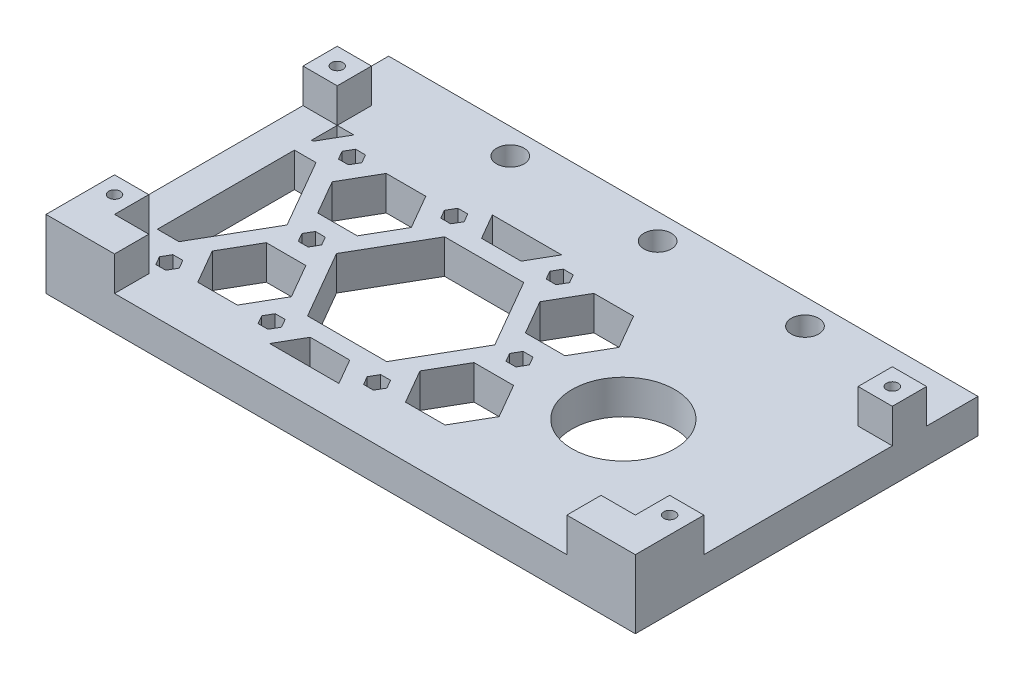
from build123d import *

# Parameters (mm, degrees)
SKETCH1_W           = 172
SKETCH1_H           = 100
SKETCH1_R           = 1.655795395
SKETCH1_R_2         = 15
BOSS_EXTRUDE1_DEPTH = 2.5
BOSS_EXTRUDE2_START = 7.5
SKETCH1_3_W         = 172
SKETCH1_3_H         = 100
SKETCH1_3_R         = 4
SKETCH1_3_R_2       = 15
BOSS_EXTRUDE2_DEPTH = 7.5
SKETCH3_W           = 10
SKETCH3_H           = 10
BOSS_EXTRUDE3_DEPTH = 10
SKETCH4_R           = 1.7
CUT_EXTRUDE1_DEPTH  = 200.959995999
CUT_EXTRUDE2_DEPTH  = 2.5
CUT_EXTRUDE3_DEPTH  = 200.208433556


with BuildPart() as part:
    # Sketch1 → Boss-Extrude1 (new body)
    with BuildSketch(Plane(origin=(0, 0, 0), x_dir=(1, 0, 0), z_dir=(0, 1, 0))):
        with Locations((86, 50)):
            Rectangle(SKETCH1_W, SKETCH1_H)
        with Locations((43, 92.5)):
            Circle(SKETCH1_R, mode=Mode.SUBTRACT)
        with Locations((86, 92.5)):
            Circle(SKETCH1_R, mode=Mode.SUBTRACT)
        with Locations((129, 92.5)):
            Circle(SKETCH1_R, mode=Mode.SUBTRACT)
        with Locations((126, 42.5)):
            Circle(SKETCH1_R_2, mode=Mode.SUBTRACT)
    extrude(amount=-BOSS_EXTRUDE1_DEPTH)

    # Sketch1<3> → Boss-Extrude2 (add)
    with BuildSketch(Plane(origin=(0, 0, 0), x_dir=(1, 0, 0), z_dir=(0, 1, 0)).offset(BOSS_EXTRUDE2_START)):
        with Locations((86, 50)):
            Rectangle(SKETCH1_3_W, SKETCH1_3_H)
        with Locations((43, 92.5)):
            Circle(SKETCH1_3_R, mode=Mode.SUBTRACT)
        with Locations((86, 92.5)):
            Circle(SKETCH1_3_R, mode=Mode.SUBTRACT)
        with Locations((129, 92.5)):
            Circle(SKETCH1_3_R, mode=Mode.SUBTRACT)
        with Locations((126, 42.5)):
            Circle(SKETCH1_3_R_2, mode=Mode.SUBTRACT)
    extrude(amount=-BOSS_EXTRUDE2_DEPTH)

    # Sketch3 → Boss-Extrude3 (add)
    with BuildSketch(Plane(origin=(0, 7.5, 0), x_dir=(1, 0, 0), z_dir=(0, 1, 0))):
        with Locations((5, 80)):
            Rectangle(SKETCH3_W, SKETCH3_H)
        with Locations((167, 80)):
            Rectangle(SKETCH3_W, SKETCH3_H)
        Polygon((10, 20), (0, 20), (0, 0), (20, 0), (20, 10), (10, 10), align=None)
        Polygon((172, 0), (172, 20), (162, 20), (162, 10), (152, 10), (152, 0), align=None)
    extrude(amount=BOSS_EXTRUDE3_DEPTH)

    # Sketch4 → Cut-Extrude1 (cut, through all)
    with BuildSketch(Plane(origin=(0, 17.5, 0), x_dir=(1, 0, 0), z_dir=(0, 1, 0))):
        with Locations((5, 80)):
            Circle(SKETCH4_R)
        with Locations((5, 15)):
            Circle(SKETCH4_R)
        with Locations((167, 15)):
            Circle(SKETCH4_R)
        with Locations((167, 80)):
            Circle(SKETCH4_R)
    extrude(amount=-CUT_EXTRUDE1_DEPTH, mode=Mode.SUBTRACT)

    # Sketch5 → Cut-Extrude2 (cut)
    with BuildSketch(Plane(origin=(0, -2.5, 0), x_dir=(-1, 0, 0), z_dir=(0, -1, 0))):
        Polygon((-163.766838493, 80), (-165.383419246, 82.8), (-168.616580754, 82.8), (-170.233161507, 80), (-168.616580754, 77.2), (-165.383419246, 77.2), align=None)
        Polygon((-163.766838493, 15), (-165.383419246, 17.8), (-168.616580754, 17.8), (-170.233161507, 15), (-168.616580754, 12.2), (-165.383419246, 12.2), align=None)
        Polygon((-1.766838493, 15), (-3.383419246, 17.8), (-6.616580754, 17.8), (-8.233161507, 15), (-6.616580754, 12.2), (-3.383419246, 12.2), align=None)
        Polygon((-1.766838493, 80), (-3.383419246, 82.8), (-6.616580754, 82.8), (-8.233161507, 80), (-6.616580754, 77.2), (-3.383419246, 77.2), align=None)
    extrude(amount=-CUT_EXTRUDE2_DEPTH, mode=Mode.SUBTRACT)

    # Sketch6 → Cut-Extrude3 (cut, through all)
    with BuildSketch(Plane(origin=(0, 7.5, 0), x_dir=(1, 0, 0), z_dir=(0, 1, 0))):
        Polygon((14.860073181, 75), (10, 75), (10, 67.5), (10.529946162, 67.5), align=None)
        Polygon((55.274592024, 75), (59.604719043, 67.5), (71.151724427, 67.5), (75.481851446, 75), align=None)
        Polygon((16.303448854, 62.5), (10, 62.5), (10, 22.5), (16.303448854, 22.5), (27.850454238, 42.5), align=None)
        Polygon((10.529946162, 17.5), (10, 17.5), (10, 10), (14.860073181, 10), align=None)
        Polygon((59.604719043, 17.5), (55.274592024, 10), (75.481851446, 10), (71.151724427, 17.5), align=None)
        Polygon((107.236116251, 25), (101.462613559, 35), (89.915608176, 35), (84.142105484, 25), (89.915608176, 15), (101.462613559, 15), align=None)
        Polygon((101.462613559, 50), (107.236116251, 60), (101.462613559, 70), (89.915608176, 70), (84.142105484, 60), (89.915608176, 50), align=None)
        Polygon((77.878641442, 69.151362049), (79.322017115, 66.651362049), (82.208768461, 66.651362049), (83.652144134, 69.151362049), (82.208768461, 71.651362049), (79.322017115, 71.651362049), align=None)
        Polygon((82.208768461, 18.348637951), (79.322017115, 18.348637951), (77.878641442, 15.848637951), (79.322017115, 13.348637951), (82.208768461, 13.348637951), (83.652144134, 15.848637951), align=None)
        Polygon((46.614337986, 25), (40.840835295, 35), (29.293829911, 35), (23.520327219, 25), (29.293829911, 15), (40.840835295, 15), align=None)
        Polygon((53.831216351, 62.5), (42.284210968, 42.5), (53.831216351, 22.5), (76.925227119, 22.5), (88.472232503, 42.5), (76.925227119, 62.5), align=None)
        Polygon((40.840835295, 50), (46.614337986, 60), (40.840835295, 70), (29.293829911, 70), (23.520327219, 60), (29.293829911, 50), align=None)
        Polygon((97.132486541, 40), (98.575862214, 42.5), (97.132486541, 45), (94.245735195, 45), (92.802359522, 42.5), (94.245735195, 40), align=None)
        Polygon((36.510708276, 40), (37.954083949, 42.5), (36.510708276, 45), (33.62395693, 45), (32.180581257, 42.5), (33.62395693, 40), align=None)
        Polygon((48.547675009, 71.651362049), (47.104299336, 69.151362049), (48.547675009, 66.651362049), (51.434426355, 66.651362049), (52.877802028, 69.151362049), (51.434426355, 71.651362049), align=None)
        Polygon((23.030365869, 69.151362049), (21.586990196, 71.651362049), (18.70023885, 71.651362049), (17.256863177, 69.151362049), (18.70023885, 66.651362049), (21.586990196, 66.651362049), align=None)
        Polygon((21.586990196, 13.348637951), (23.030365869, 15.848637951), (21.586990196, 18.348637951), (18.70023885, 18.348637951), (17.256863177, 15.848637951), (18.70023885, 13.348637951), align=None)
        Polygon((47.104299336, 15.848637951), (48.547675009, 13.348637951), (51.434426355, 13.348637951), (52.877802028, 15.848637951), (51.434426355, 18.348637951), (48.547675009, 18.348637951), align=None)
    extrude(amount=-CUT_EXTRUDE3_DEPTH, mode=Mode.SUBTRACT)


solid = part.part
